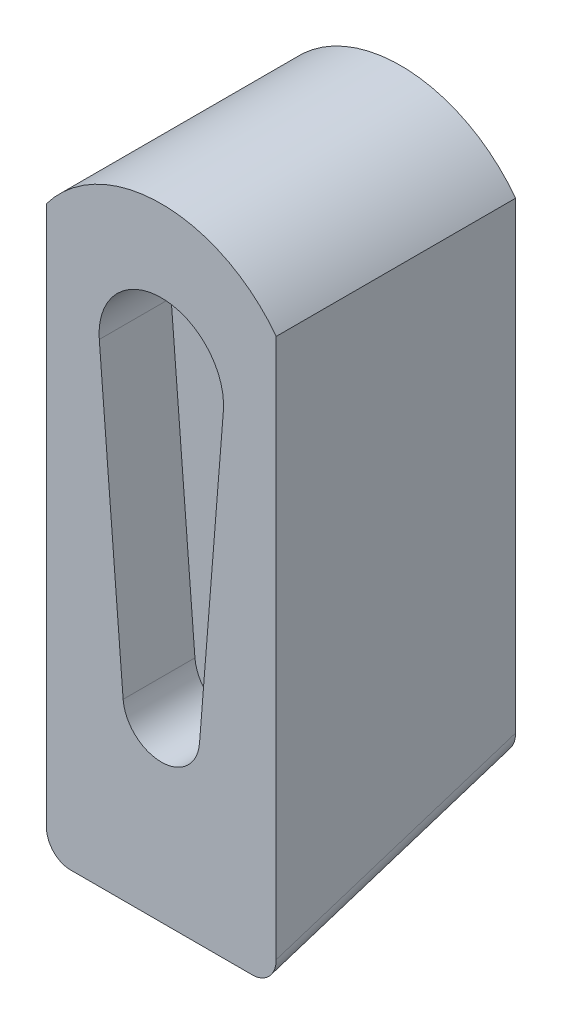
from build123d import *

# Parameters (mm, degrees)
BOSS_EXTRUDE1_DEPTH     = 12.7
CUT_EXTRUDE1_DEPTH      = 37.367265501
CUT_EXTRUDE1_DEPTH_BACK = 3.81
CUT_EXTRUDE2_DEPTH      = 38.86900643
SKETCH4_R               = 1.5875
CUT_EXTRUDE3_DEPTH      = 28.592631553
SKETCH5_R               = 3.175
CUT_EXTRUDE4_DEPTH      = 6.35
CHAMFER1_SIZE           = 1.016
FILLET1_R               = 1.27


with BuildPart() as part:
    # Sketch1 → Boss-Extrude1 (new body)
    with BuildSketch(Plane.XY):
        with BuildLine():
            Line((-6.096, 4.572), (-6.096, -33.528))
            Line((-6.096, -33.528), (6.096, -33.528))
            Line((6.096, -33.528), (6.096, 4.572))
            ThreePointArc((6.096, 4.572), (0, 7.62), (-6.096, 4.572))
        make_face()
    extrude(amount=BOSS_EXTRUDE1_DEPTH)

    # Sketch2 → Cut-Extrude1 (cut, two sides: drawn at the far end of the back side and taken through both)
    with BuildSketch(Plane.XY.offset(12.7).offset(-CUT_EXTRUDE1_DEPTH_BACK)):
        with BuildLine():
            Line((3.291584227, -0.262063492), (2.025590294, -16.163269841))
            ThreePointArc((2.025590294, -16.163269841), (0, -18.034), (-2.025590294, -16.163269841))
            Line((-2.025590294, -16.163269841), (-3.291584227, -0.262063492))
            ThreePointArc((-3.291584227, -0.262063492), (0, 3.302), (3.291584227, -0.262063492))
        make_face()
    extrude(amount=CUT_EXTRUDE1_DEPTH + CUT_EXTRUDE1_DEPTH_BACK, mode=Mode.SUBTRACT)

    # Sketch3 → Cut-Extrude2 (cut, through all)
    with BuildSketch(Plane(origin=(6.096, 0, 0), x_dir=(0, 0, -1), z_dir=(1, 0, 0))):
        Polygon((-12.7, -33.528), (-12.7, -25.4), (0, -21.336), (0, -33.528), align=None)
    extrude(amount=-CUT_EXTRUDE2_DEPTH, mode=Mode.SUBTRACT)

    # Sketch4 → Cut-Extrude3 (cut, through all)
    with BuildSketch(Plane.XY.offset(8.89)):
        Circle(SKETCH4_R)
    extrude(amount=-CUT_EXTRUDE3_DEPTH, mode=Mode.SUBTRACT)

    # Sketch5 → Cut-Extrude4 (cut)
    with BuildSketch(Plane(origin=(0, 0, 0), x_dir=(-1, 0, 0), z_dir=(0, 0, -1))):
        Circle(SKETCH5_R)
    extrude(amount=-CUT_EXTRUDE4_DEPTH, mode=Mode.SUBTRACT)

    # Chamfer1
    chamfer1_edges = [part.edges().sort_by_distance(p)[0] for p in [
        (3.175, 0, 6.35),
    ]]
    chamfer(chamfer1_edges, length=CHAMFER1_SIZE)

    # Fillet1
    fillet1_edges = [part.edges().sort_by_distance(p)[0] for p in [
        (-6.096, -23.368, 6.35),
        (6.096, -23.368, 6.35),
    ]]
    fillet(fillet1_edges, radius=FILLET1_R)


solid = part.part
